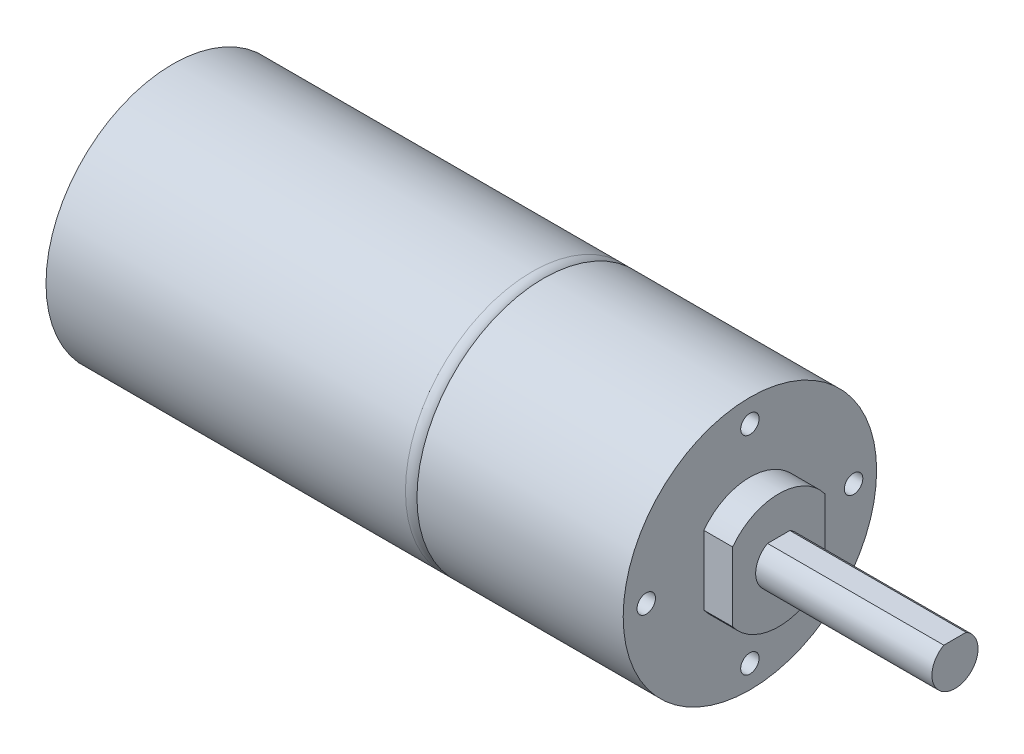
from build123d import *

# Parameters (mm, degrees)
SKETCH1_R           = 11
BOSS_EXTRUDE1_DEPTH = 17.9
BOSS_EXTRUDE2_START = 32.2
SKETCH2_R           = 11
BOSS_EXTRUDE2_DEPTH = 32.2
BOSS_EXTRUDE3_DEPTH = 2.5
BOSS_EXTRUDE4_DEPTH = 15.3


# Read off the part's stored shape, not the designer's step: AdvancedHole1
with BuildPart() as part:
    # Sketch1 → Boss-Extrude1 (new body)
    with BuildSketch(Plane(origin=(0, 0, 0), x_dir=(0, 0, -1), z_dir=(1, 0, 0))):
        with Locations(Location((0, 0, 0), (0, 0, 180))):
            Circle(SKETCH1_R)
    extrude(amount=BOSS_EXTRUDE1_DEPTH)

    # Sketch2 → Boss-Extrude2 (add)
    with BuildSketch(Plane.ZY.offset(BOSS_EXTRUDE2_START)):
        Circle(SKETCH2_R)
    extrude(amount=-BOSS_EXTRUDE2_DEPTH)

    # Sketch3 → Cut-Revolve1 (revolve, cut)
    with BuildSketch(Plane.XY, mode=Mode.PRIVATE) as cut_revolve1_sk:
        with BuildLine():
            Line((0, 11), (0, 10))
            ThreePointArc((0, 10), (-0.292893219, 10.707106781), (-1, 11))
            Line((-1, 11), (0, 11))
        make_face()
    revolve(cut_revolve1_sk.sketch.rotate(Axis((17.9, 0, 0), (-1, 0, 0)), 270), axis=Axis((17.9, 0, 0), (-1, 0, 0)), mode=Mode.SUBTRACT)

    # Sketch4 → Boss-Extrude3 (add)
    with BuildSketch(Plane(origin=(17.9, 0, 0), x_dir=(0, 0, -1), z_dir=(1, 0, 0))):
        with BuildLine():
            ThreePointArc((4, 3), (2.236067977, 4.472135955), (0, 5))
            Line((0, 5), (0, -5))
            ThreePointArc((0, -5), (2.236067977, -4.472135955), (4, -3))
            Line((4, -3), (4, 3))
        make_face()
        with BuildLine():
            ThreePointArc((0, 5), (-2.236067977, 4.472135955), (-4, 3))
            Line((-4, 3), (-4, -3))
            ThreePointArc((-4, -3), (-2.236067977, -4.472135955), (0, -5))
            Line((0, -5), (0, 5))
        make_face()
    extrude(amount=BOSS_EXTRUDE3_DEPTH)

    # Sketch5 → Boss-Extrude4 (add)
    with BuildSketch(Plane(origin=(20.4, 0, 0), x_dir=(0, 0, -1), z_dir=(1, 0, 0))):
        with BuildLine():
            Line((0.968245837, 1.75), (-0.968245837, 1.75))
            ThreePointArc((-0.968245837, 1.75), (-1.015753003, -1.722859784), (2, 0))
            ThreePointArc((2, 0), (1.722859784, 1.015753003), (0.968245837, 1.75))
        make_face()
    extrude(amount=BOSS_EXTRUDE4_DEPTH)

    # AdvancedHole1 outline → AdvancedHole1 (revolve, cut)
    with BuildSketch(Plane(origin=(0, -9, 0), x_dir=(0, 1, 0), z_dir=(0, 0, -1))):
        Polygon((0, 14.219311505), (0.8, 14.7), (0.8, 17.9), (0, 17.9), align=None)
    revolve(axis=Axis((0, -9, 0), (1, 0, 0)), mode=Mode.SUBTRACT)

    # AdvancedHole1 2 outline → AdvancedHole1 2 (revolve, cut)
    with BuildSketch(Plane.YX.offset(9)):
        Polygon((0, 14.219311505), (0.8, 14.7), (0.8, 17.9), (0, 17.9), align=None)
    revolve(axis=Axis((0, 0, -9), (1, 0, 0)), mode=Mode.SUBTRACT)

    # AdvancedHole1 3 outline → AdvancedHole1 3 (revolve, cut)
    with BuildSketch(Plane.YX.offset(-9)):
        Polygon((0, 14.219311505), (0.8, 14.7), (0.8, 17.9), (0, 17.9), align=None)
    revolve(axis=Axis((0, 0, 9), (1, 0, 0)), mode=Mode.SUBTRACT)

    # AdvancedHole1 4 outline → AdvancedHole1 4 (revolve, cut)
    with BuildSketch(Plane(origin=(0, 9, 0), x_dir=(0, 1, 0), z_dir=(0, 0, -1))):
        Polygon((0, 14.219311505), (0.8, 14.7), (0.8, 17.9), (0, 17.9), align=None)
    revolve(axis=Axis((0, 9, 0), (1, 0, 0)), mode=Mode.SUBTRACT)


solid = part.part
